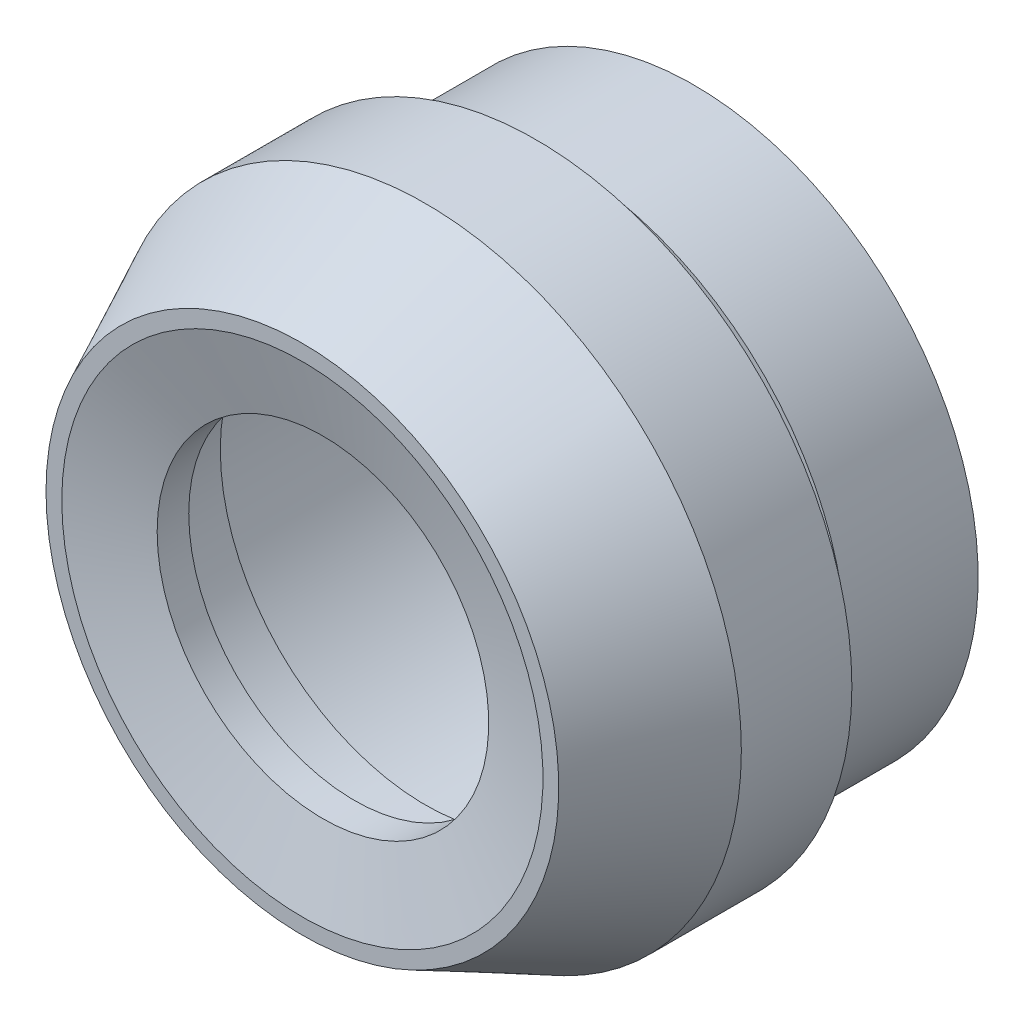
from build123d import *


with BuildPart() as part:
    # Çizim4 → Döndür2 (revolve)
    with BuildSketch(Plane(origin=(0, 0, 0), x_dir=(0, 0, -1), z_dir=(1, 0, 0))):
        Polygon((-24, 32), (10, 32), (10, 36), (-6.713637051, 36), (-6.713637051, 35), (-10, 35), (-10, 40), (-24, 40), (-39.605188956, 32.47427306), (-39.605188956, 30.47427306), (-37, 21), (-33, 21), (-33, 23), (-34, 23), (-34, 26), (-24, 26), align=None)
    revolve(axis=Axis((0, 0, -59.187405522), (0, 0, 1)))


solid = part.part
